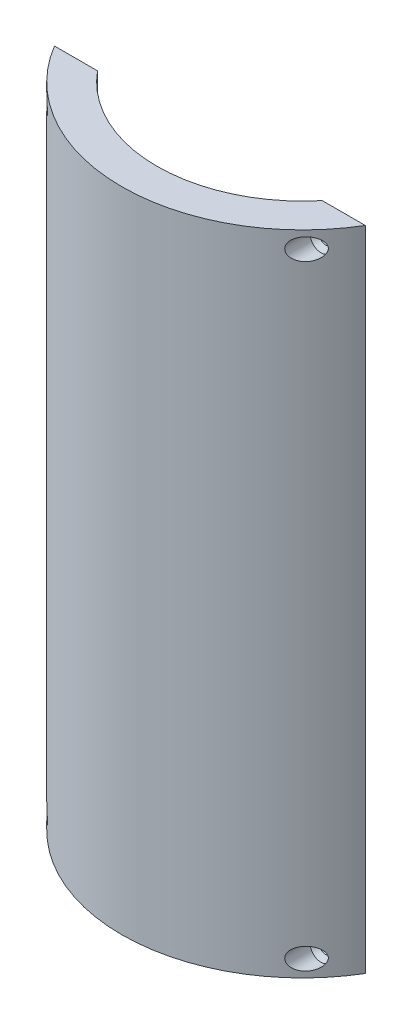
from build123d import *

# Parameters (mm, degrees)
BOSS_EXTRUDE1_DEPTH = 175


with BuildPart() as part:
    # Sketch1 → Boss-Extrude1 (new body)
    with BuildSketch(Plane(origin=(0, 0, 0), x_dir=(1, 0, 0), z_dir=(0, 1, 0))):
        with BuildLine():
            ThreePointArc((30.348758021, -25.07), (0, -39.364349524), (-30.348758021, -25.07))
            Line((-30.348758021, -25.07), (-41.978758021, -25.07))
            ThreePointArc((-41.978758021, -25.07), (0, -48.895), (41.978758021, -25.07))
            Line((41.978758021, -25.07), (30.348758021, -25.07))
        make_face()
    extrude(amount=BOSS_EXTRUDE1_DEPTH)

    # Sketch6 → Cut-Revolve4 (revolve, cut)
    with BuildSketch(Plane(origin=(34.962080117, 4.5125, 25.07), x_dir=(-1, 0, 0), z_dir=(0, -1, 0))):
        Polygon((0, 1.685394277), (0, -4.78184701), (0, -15.185924704), (-2.9, -15.185924704), (-2.9, -4.968389004), (-1.65, -3.771328265), (-1.65, 1.685394277), align=None)
    cut_revolve4 = revolve(axis=Axis((34.962080117, 4.5125, 23.384605723), (0, 0, 1)), mode=Mode.SUBTRACT)

    # Mirror1: Cut-Revolve4 across plane
    add(cut_revolve4.mirror(Plane(origin=(0, 87.5, 0), x_dir=(0, 0, 1), z_dir=(0, -1, 0))), mode=Mode.SUBTRACT)

    # Mirror1 at the second plane: Cut-Revolve4 across plane
    add(cut_revolve4.mirror(Plane(origin=(0, 0, 0), x_dir=(0, 0, 1), z_dir=(1, 0, 0))), mode=Mode.SUBTRACT)

    # Mirror1 at the second plane copy 1 sketc → Mirror1 at the second plane copy 1 (revolve, cut)
    with BuildSketch(Plane(origin=(-34.962080117, 170.4875, 25.07), x_dir=(1, 0, 0), z_dir=(0, 1, 0))):
        Polygon((0, 1.685394277), (0, -4.78184701), (0, -15.185924704), (-2.9, -15.185924704), (-2.9, -4.968389004), (-1.65, -3.771328265), (-1.65, 1.685394277), align=None)
    revolve(axis=Axis((-34.962080117, 170.4875, 23.384605723), (0, 0, 1)), mode=Mode.SUBTRACT)


solid = part.part
